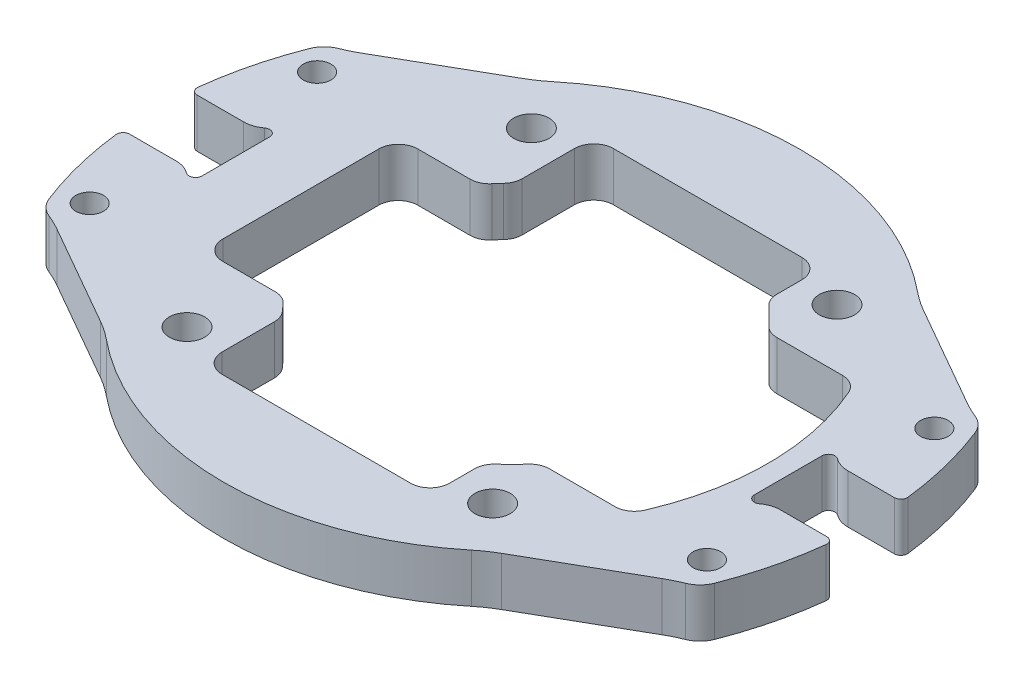
from build123d import *

# Parameters (mm, degrees)
STOCK_DGT_START                               = 19.05
STOCK_DGT_INSIDE_SWERVE_STRUCTURE_SM_2_R      = 1.7272
STOCK_DGT_INSIDE_SWERVE_STRUCTURE_SM_2_R_2    = 1.35255
STOCK_DGT_INSIDE_SWERVE_STRUCTURE_SMALL_DEPTH = 4.7625
SKETCH2_W                                     = 7.792882402
SKETCH2_H                                     = 6.604
CUT_EXTRUDE2_DEPTH                            = 46.013187304
CUT_EXTRUDE1_DEPTH                            = 46.013187304
FILLET1_R                                     = 2.54
FILLET2_R                                     = 2.54
FILLET3_R                                     = 12.7
FILLET4_R                                     = 1.905
FILLET5_R                                     = 0.635


# Read off the part's stored shape, not the designer's step: Stock-DGT inside swerve structure Small Bearing-1
with BuildPart() as part:
    # Stock-DGT inside swerve structure Sm 2 → Stock-DGT inside swerve structure Small Bearing-1 (new body)
    with BuildSketch(Plane(origin=(0, 0, 0), x_dir=(1, 0, 0), z_dir=(0, 1, 0)).offset(STOCK_DGT_START)):
        with BuildLine():
            Line((26.9875, 3.175), (34.780382402, 3.175))
            ThreePointArc((34.780382402, 3.175), (33.784635987, 8.851779269), (31.868840091, 14.2875))
            Line((31.868840091, 14.2875), (30.633697592, 14.2875))
            Line((30.633697592, 14.2875), (18.578944076, 21.181441452))
            ThreePointArc((18.578944076, 21.181441452), (0, 28.175), (-18.578944076, 21.181441452))
            Line((-18.578944076, 21.181441452), (-30.633697592, 14.2875))
            Line((-30.633697592, 14.2875), (-31.868840091, 14.2875))
            ThreePointArc((-31.868840091, 14.2875), (-33.784635987, 8.851779269), (-34.780382402, 3.175))
            Line((-34.780382402, 3.175), (-26.9875, 3.175))
            Line((-26.9875, 3.175), (-26.9875, -3.175))
            Line((-26.9875, -3.175), (-34.780382402, -3.175))
            ThreePointArc((-34.780382402, -3.175), (-33.784635987, -8.851779269), (-31.868840091, -14.2875))
            Line((-31.868840091, -14.2875), (-30.633697592, -14.2875))
            Line((-30.633697592, -14.2875), (-18.578944076, -21.181441452))
            ThreePointArc((-18.578944076, -21.181441452), (0, -28.175), (18.578944076, -21.181441452))
            Line((18.578944076, -21.181441452), (30.633697592, -14.2875))
            Line((30.633697592, -14.2875), (31.868840091, -14.2875))
            ThreePointArc((31.868840091, -14.2875), (33.784635987, -8.851779269), (34.780382402, -3.175))
            Line((34.780382402, -3.175), (26.9875, -3.175))
            Line((26.9875, -3.175), (26.9875, 3.175))
        make_face()
        with Locations((-14.933176064, -16.8275)):
            Circle(STOCK_DGT_INSIDE_SWERVE_STRUCTURE_SM_2_R, mode=Mode.SUBTRACT)
        with Locations((-30.1625, -11.1125)):
            Circle(STOCK_DGT_INSIDE_SWERVE_STRUCTURE_SM_2_R_2, mode=Mode.SUBTRACT)
        with Locations((14.933176064, -16.8275)):
            Circle(STOCK_DGT_INSIDE_SWERVE_STRUCTURE_SM_2_R, mode=Mode.SUBTRACT)
        with Locations((30.1625, -11.1125)):
            Circle(STOCK_DGT_INSIDE_SWERVE_STRUCTURE_SM_2_R_2, mode=Mode.SUBTRACT)
        with Locations((-30.1625, 11.1125)):
            Circle(STOCK_DGT_INSIDE_SWERVE_STRUCTURE_SM_2_R_2, mode=Mode.SUBTRACT)
        with Locations((-14.933176064, 16.8275)):
            Circle(STOCK_DGT_INSIDE_SWERVE_STRUCTURE_SM_2_R, mode=Mode.SUBTRACT)
        with BuildLine():
            Line((22.394471276, -11.1125), (13.879508051, -11.1125))
            ThreePointArc((13.879508051, -11.1125), (12.572358569, -12.572358569), (11.1125, -13.879508051))
            Line((11.1125, -13.879508051), (11.1125, -19.116031394))
            Line((11.1125, -19.116031394), (-11.1125, -19.116031394))
            Line((-11.1125, -19.116031394), (-11.1125, -11.33701763))
            ThreePointArc((-11.1125, -11.33701763), (-11.940671716, -10.461165517), (-12.7, -9.525))
            Line((-12.7, -9.525), (-20.6375, -9.525))
            Line((-20.6375, -9.525), (-20.6375, 9.525))
            Line((-20.6375, 9.525), (-12.7, 9.525))
            ThreePointArc((-12.7, 9.525), (-11.940671716, 10.461165517), (-11.1125, 11.33701763))
            Line((-11.1125, 11.33701763), (-11.1125, 19.116031394))
            Line((-11.1125, 19.116031394), (11.1125, 19.116031394))
            Line((11.1125, 19.116031394), (11.1125, 13.879508051))
            ThreePointArc((11.1125, 13.879508051), (12.572358569, 12.572358569), (13.879508051, 11.1125))
            Line((13.879508051, 11.1125), (22.394471276, 11.1125))
            ThreePointArc((22.394471276, 11.1125), (25, 0), (22.394471276, -11.1125))
        make_face(mode=Mode.SUBTRACT)
        with Locations((30.1625, 11.1125)):
            Circle(STOCK_DGT_INSIDE_SWERVE_STRUCTURE_SM_2_R_2, mode=Mode.SUBTRACT)
        with Locations((14.933176064, 16.8275)):
            Circle(STOCK_DGT_INSIDE_SWERVE_STRUCTURE_SM_2_R, mode=Mode.SUBTRACT)
    extrude(amount=STOCK_DGT_INSIDE_SWERVE_STRUCTURE_SMALL_DEPTH)

    # Sketch2 → Cut-Extrude2 (cut, through all)
    with BuildSketch(Plane(origin=(0, 23.8125, 0), x_dir=(1, 0, 0), z_dir=(0, 1, 0))):
        with Locations((-30.883941201, 0)):
            Rectangle(SKETCH2_W, SKETCH2_H)
    cut_extrude2 = extrude(amount=-CUT_EXTRUDE2_DEPTH, mode=Mode.SUBTRACT)

    # Sketch1 → Cut-Extrude1 (cut, through all)
    with BuildSketch(Plane(origin=(0, 23.8125, 0), x_dir=(1, 0, 0), z_dir=(0, 1, 0))):
        with BuildLine():
            Line((-28.2575, -3.302), (-28.2575, 3.302))
            ThreePointArc((-28.2575, 3.302), (-27.6225, 3.937), (-26.9875, 3.302))
            Line((-26.9875, 3.302), (-26.9875, -3.302))
            ThreePointArc((-26.9875, -3.302), (-27.6225, -3.937), (-28.2575, -3.302))
        make_face()
    cut_extrude1 = extrude(amount=-CUT_EXTRUDE1_DEPTH, mode=Mode.SUBTRACT)

    # Mirror1: Cut-Extrude2, Cut-Extrude1 across plane
    add(cut_extrude2.mirror(Plane(origin=(0, 0, 0), x_dir=(0, 0, 1), z_dir=(1, 0, 0))), mode=Mode.SUBTRACT)
    add(cut_extrude1.mirror(Plane(origin=(0, 0, 0), x_dir=(0, 0, 1), z_dir=(1, 0, 0))), mode=Mode.SUBTRACT)

    # Fillet1
    fillet1_edges = [part.edges().sort_by_distance(p)[0] for p in [
        (-28.2575, 21.43125, 3.302),
        (-28.2575, 21.43125, -3.302),
        (28.2575, 21.43125, 3.302),
        (28.2575, 21.43125, -3.302),
    ]]
    fillet(fillet1_edges, radius=FILLET1_R)

    # Fillet2
    # the kernel refuses this fillet: 2.54 mm, written as the material it takes off along each edge
    with BuildSketch(Plane(origin=(31.868840091, 14.791233758, -14.2875), x_dir=(-1, 0, 0), z_dir=(0, 1, 0))) as fillet2_piece_1:
        with BuildLine():
            CenterArc((1.70687253, 2.495810645), FILLET2_R, 201.352796162, 57.94406273)
            Line((-0.658771985, 1.570972265), (-0.706084875, 1.552475497))
            ThreePointArc((-0.706084875, 1.552475497), (-0.385813379, 0.761823855), (-0.046354676, -0.020781818))
            Line((-0.046354676, -0.020781818), (0, -0.0508))
            ThreePointArc((0, -0.0508), (0.61757125, -0.0508), (1.225707898, -0.049916213))
            Line((1.225707898, -0.049916213), (1.235142499, 0))
        make_face()
    extrude(amount=13.280032484, mode=Mode.SUBTRACT)
    with BuildSketch(Plane(origin=(31.868840091, 14.791233758, 14.2875), x_dir=(-1, 0, 0), z_dir=(0, 1, 0))) as fillet2_piece_2:
        with BuildLine():
            CenterArc((1.70687253, -2.495810645), FILLET2_R, 100.703141108, 57.94406273)
            Line((-0.658771985, -1.570972265), (-0.706084875, -1.552475497))
            ThreePointArc((-0.706084875, -1.552475497), (-0.385813379, -0.761823855), (-0.046354676, 0.020781818))
            Line((-0.046354676, 0.020781818), (0, 0.0508))
            ThreePointArc((0, 0.0508), (0.61757125, 0.0508), (1.225707898, 0.049916213))
            Line((1.225707898, 0.049916213), (1.235142499, 0))
        make_face()
    extrude(amount=13.280032484, mode=Mode.SUBTRACT)
    with BuildSketch(Plane(origin=(-31.868840091, 14.791233758, 14.2875), x_dir=(-0.3867152758408876, 0, -0.9221991625626789), z_dir=(0, 1, 0))) as fillet2_piece_3:
        with BuildLine():
            CenterArc((1.641560806, -2.53924452), FILLET2_R, 88.602528123, 57.94406273)
            Line((-0.477648472, -1.139047378), (-0.520032658, -1.111043435))
            ThreePointArc((-0.520032658, -1.111043435), (-0.285671954, -0.549878553), (-0.046847717, 0.019645136))
            Line((-0.046847717, 0.019645136), (-0.001238914, 0.05078489))
            ThreePointArc((-0.001238914, 0.05078489), (0.851753248, 0.061187853), (1.704745411, 0.05078489))
            Line((1.704745411, 0.05078489), (1.703506497, 0))
        make_face()
    extrude(amount=13.280032484, mode=Mode.SUBTRACT)
    with BuildSketch(Plane(origin=(-31.868840091, 14.791233758, -14.2875), x_dir=(-0.3867152758408886, 0, 0.9221991625626784), z_dir=(0, 1, 0))) as fillet2_piece_4:
        with BuildLine():
            CenterArc((1.641560806, 2.53924452), FILLET2_R, 213.453409147, 57.94406273)
            Line((-0.477648472, 1.139047378), (-0.520032658, 1.111043435))
            ThreePointArc((-0.520032658, 1.111043435), (-0.285671954, 0.549878553), (-0.046847717, -0.019645136))
            Line((-0.046847717, -0.019645136), (-0.001238914, -0.05078489))
            ThreePointArc((-0.001238914, -0.05078489), (0.851753248, -0.061187853), (1.704745411, -0.05078489))
            Line((1.704745411, -0.05078489), (1.703506497, 0))
        make_face()
    extrude(amount=13.280032484, mode=Mode.SUBTRACT)

    # Fillet3
    fillet3_edges = [part.edges().sort_by_distance(p)[0] for p in [
        (-18.578944076, 21.43125, -21.181441452),
        (18.578944076, 21.43125, -21.181441452),
        (30.633697592, 21.43125, -14.2875),
        (-30.633697592, 21.43125, -14.2875),
        (30.633697592, 21.43125, 14.2875),
        (-18.578944076, 21.43125, 21.181441452),
        (18.578944076, 21.43125, 21.181441452),
        (-30.633697592, 21.43125, 14.2875),
    ]]
    fillet(fillet3_edges, radius=FILLET3_R)

    # Fillet4
    fillet4_edges = [part.edges().sort_by_distance(p)[0] for p in [
        (11.1125, 21.43125, 19.116031394),
        (-11.1125, 21.43125, -19.116031394),
        (11.1125, 21.43125, -19.116031394),
        (-11.1125, 21.43125, 19.116031394),
        (-12.7, 21.43125, -9.525),
        (-12.7, 21.43125, 9.525),
        (-20.6375, 21.43125, 9.525),
        (-20.6375, 21.43125, -9.525),
        (22.394471276, 21.43125, 11.1125),
        (22.394471276, 21.43125, -11.1125),
        (11.1125, 21.43125, -13.879508051),
        (11.1125, 21.43125, 13.879508051),
        (13.879508051, 21.43125, 11.1125),
        (13.879508051, 21.43125, -11.1125),
        (-11.1125, 21.43125, 11.33701763),
        (-11.1125, 21.43125, -11.33701763),
    ]]
    fillet(fillet4_edges, radius=FILLET4_R)

    # Fillet5
    fillet5_edges = [part.edges().sort_by_distance(p)[0] for p in [
        (-34.768555061, 21.43125, 3.302),
        (-34.768555061, 21.43125, -3.302),
        (34.768555061, 21.43125, 3.302),
        (34.768555061, 21.43125, -3.302),
    ]]
    fillet(fillet5_edges, radius=FILLET5_R)


solid = part.part
